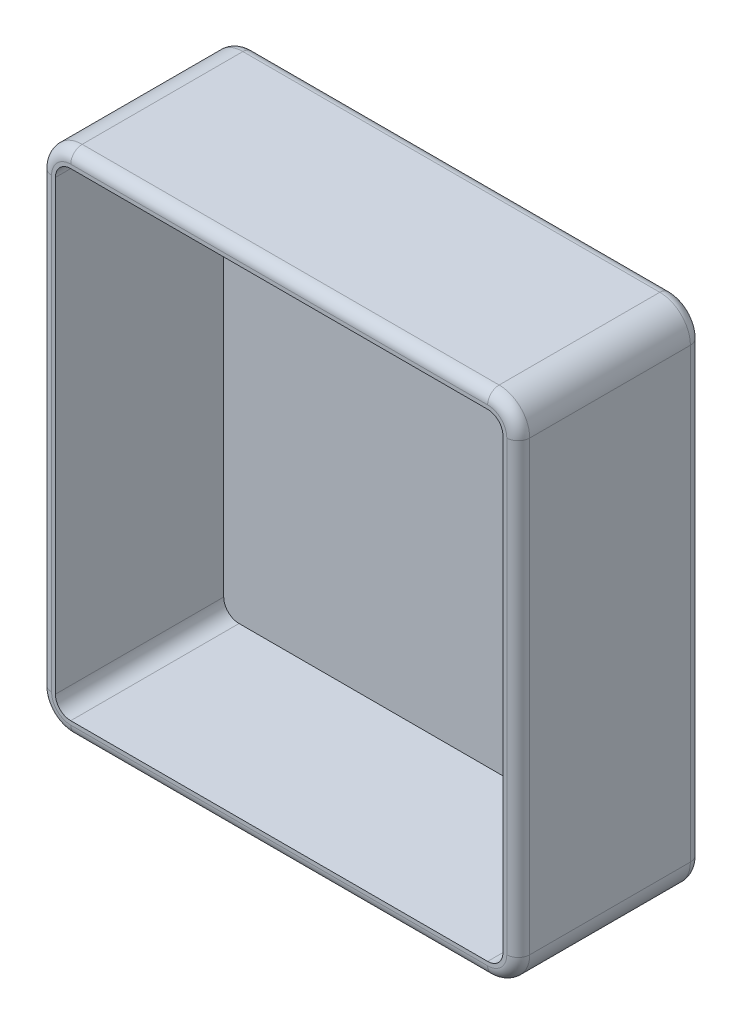
from build123d import *

# Parameters (mm, degrees)
BOSS_EXTRU_1_DEPTH = 22
COQUE1_T           = 2
CONG_1_R           = 1.5
CONG_2_R           = 1.5


with BuildPart() as part:
    # Esquisse1 → Boss.-Extru.1 (new body)
    with BuildSketch(Plane.XY):
        with BuildLine():
            Line((2, 0), (56.5, 0))
            ThreePointArc((56.5, 0), (57.914213562, 0.585786438), (58.5, 2))
            Line((58.5, 2), (58.5, 60.5))
            ThreePointArc((58.5, 60.5), (57.914213562, 61.914213562), (56.5, 62.5))
            Line((56.5, 62.5), (2, 62.5))
            ThreePointArc((2, 62.5), (0.585786438, 61.914213562), (0, 60.5))
            Line((0, 60.5), (0, 2))
            ThreePointArc((0, 2), (0.585786438, 0.585786438), (2, 0))
        make_face()
    extrude(amount=BOSS_EXTRU_1_DEPTH)

    # Coque1
    coque1_openings = [part.faces().sort_by_distance(p)[0] for p in [
        (29.25, 31.25, 22),
    ]]
    offset(amount=COQUE1_T, openings=coque1_openings, kind=Kind.INTERSECTION)

    # Congé1
    # the kernel refuses this fillet: 1.5 mm, written as the material it takes off along each edge
    with BuildSketch(Plane(origin=(56.5, 60.5, 22), x_dir=(0, 1, 0), z_dir=(-1, 0, 0))) as cong_1_piece_1:
        with BuildLine():
            CenterArc((4 - CONG_1_R, CONG_1_R), CONG_1_R, 270, 90)
            Line((4, CONG_1_R), (4, 0))
            Line((4, 0), (4 - CONG_1_R, 0))
        make_face()
    revolve(axis=Axis((56.5, 60.5, 22), (0, 0, -1)), revolution_arc=90, mode=Mode.SUBTRACT)
    with BuildSketch(Plane(origin=(2, 64.5, 22), x_dir=(0, -1, 0), z_dir=(1, 0, 0)), Plane(origin=(56.5, -2, 22), x_dir=(0, 1, 0), z_dir=(-1, 0, 0))) as cong_1_piece_2:
        with BuildLine():
            CenterArc((CONG_1_R, CONG_1_R), CONG_1_R, 180, 90)
            Line((0, CONG_1_R), (0, 0))
            Line((0, 0), (CONG_1_R, 0))
        make_face()
    extrude(amount=54.5, mode=Mode.SUBTRACT)
    with BuildSketch(Plane(origin=(2, 60.5, 22), x_dir=(-1, 0, 0), z_dir=(0, -1, 0))) as cong_1_piece_3:
        with BuildLine():
            CenterArc((4 - CONG_1_R, CONG_1_R), CONG_1_R, 270, 90)
            Line((4, CONG_1_R), (4, 0))
            Line((4, 0), (4 - CONG_1_R, 0))
        make_face()
    revolve(axis=Axis((2, 60.5, 22), (0, 0, -1)), revolution_arc=90, mode=Mode.SUBTRACT)
    with BuildSketch(Plane(origin=(-2, 2, 22), x_dir=(1, 0, 0), z_dir=(0, 1, 0)), Plane(origin=(60.5, 60.5, 22), x_dir=(-1, 0, 0), z_dir=(0, -1, 0))) as cong_1_piece_4:
        with BuildLine():
            CenterArc((CONG_1_R, CONG_1_R), CONG_1_R, 180, 90)
            Line((0, CONG_1_R), (0, 0))
            Line((0, 0), (CONG_1_R, 0))
        make_face()
    extrude(amount=58.5, mode=Mode.SUBTRACT)
    with BuildSketch(Plane(origin=(2, 2, 22), x_dir=(0, -1, 0), z_dir=(1, 0, 0))) as cong_1_piece_5:
        with BuildLine():
            CenterArc((4 - CONG_1_R, CONG_1_R), CONG_1_R, 270, 90)
            Line((4, CONG_1_R), (4, 0))
            Line((4, 0), (4 - CONG_1_R, 0))
        make_face()
    revolve(axis=Axis((2, 2, 22), (0, 0, -1)), revolution_arc=90, mode=Mode.SUBTRACT)
    with BuildSketch(Plane(origin=(56.5, 2, 22), x_dir=(1, 0, 0), z_dir=(0, 1, 0))) as cong_1_piece_6:
        with BuildLine():
            CenterArc((4 - CONG_1_R, CONG_1_R), CONG_1_R, 270, 90)
            Line((4, CONG_1_R), (4, 0))
            Line((4, 0), (4 - CONG_1_R, 0))
        make_face()
    revolve(axis=Axis((56.5, 2, 22), (0, 0, -1)), revolution_arc=90, mode=Mode.SUBTRACT)

    # Congé2
    cong_2_edges = [part.edges().sort_by_distance(p)[0] for p in [
        (29.25, 64.5, -2),
        (59.328427125, 63.328427125, -2),
        (60.5, 31.25, -2),
        (59.328427125, -0.828427125, -2),
        (29.25, -2, -2),
        (-0.828427125, -0.828427125, -2),
        (-2, 31.25, -2),
        (-0.828427125, 63.328427125, -2),
    ]]
    fillet(cong_2_edges, radius=CONG_2_R)


solid = part.part
